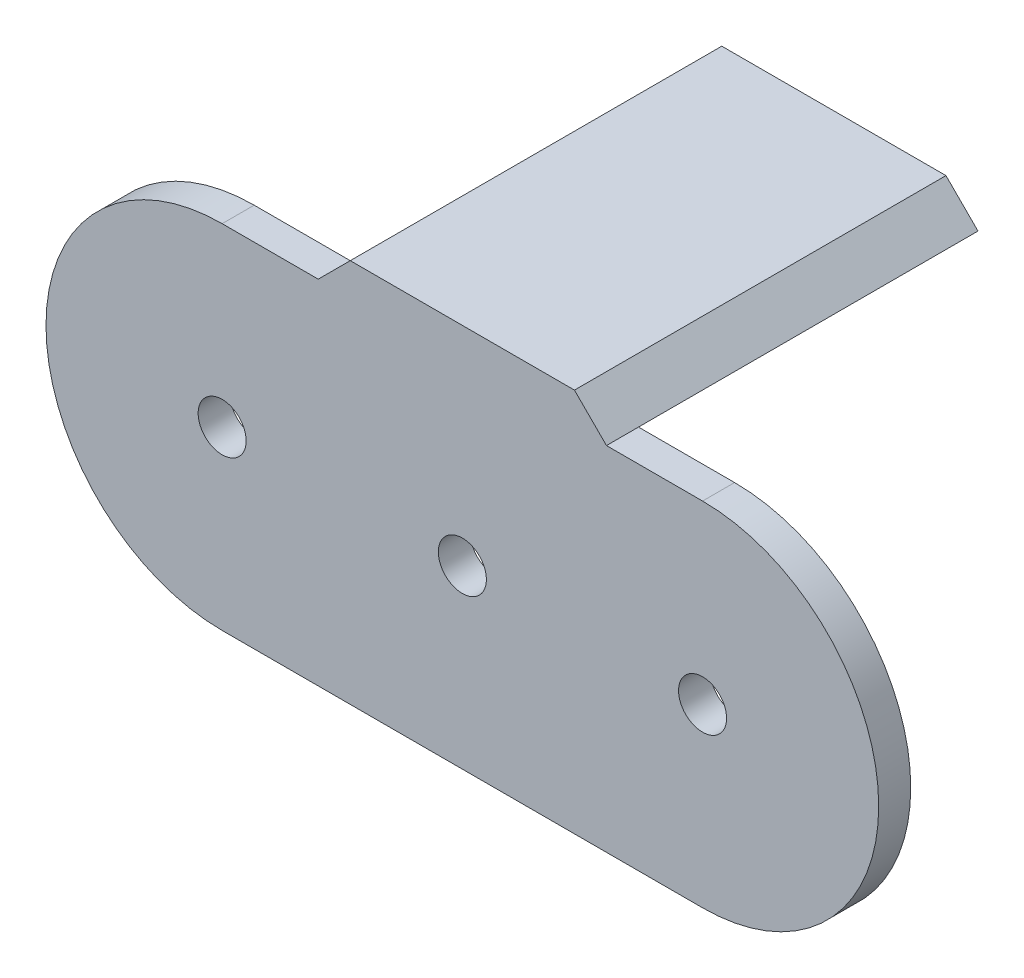
from build123d import *

# Parameters (mm, degrees)
SKETCH1_R           = 1.5
BOSS_EXTRUDE1_DEPTH = 2
SKETCH2_W           = 18
SKETCH2_H           = 23.2
BOSS_EXTRUDE2_DEPTH = 2
CHAMFER1_SIZE       = 2


with BuildPart() as part:
    # Sketch1 → Boss-Extrude1 (new body)
    with BuildSketch(Plane.XY):
        with BuildLine():
            Line((-15, 11), (15, 11))
            ThreePointArc((15, 11), (26, 0), (15, -11))
            Line((15, -11), (-15, -11))
            ThreePointArc((-15, -11), (-26, 0), (-15, 11))
        make_face()
        with Locations((-15, 0)):
            Circle(SKETCH1_R, mode=Mode.SUBTRACT)
        with Locations((15, 0)):
            Circle(SKETCH1_R, mode=Mode.SUBTRACT)
        Circle(SKETCH1_R, mode=Mode.SUBTRACT)
    extrude(amount=BOSS_EXTRUDE1_DEPTH)

    # Sketch2 → Boss-Extrude2 (add)
    with BuildSketch(Plane(origin=(0, 11, 0), x_dir=(1, 0, 0), z_dir=(0, 1, 0))):
        with Locations((0, 9.6)):
            Rectangle(SKETCH2_W, SKETCH2_H)
    extrude(amount=BOSS_EXTRUDE2_DEPTH)

    # Chamfer1
    # the kernel refuses this chamfer: 2 mm, written as the material it takes off along each edge
    with BuildSketch(Plane(origin=(-9, 13, -26.343365976), x_dir=(-0.027495876610586487, -0.9996219169112968, 0), z_dir=(0, 0, 1)), Plane(origin=(9, 13, 7.143365976), x_dir=(0.027495876610586487, -0.9996219169112968, 0), z_dir=(0, 0, -1))) as chamfer1_piece_1:
        Polygon((CHAMFER1_SIZE * 0.999621916911, CHAMFER1_SIZE * 0.0274958766106), (-CHAMFER1_SIZE * 0.0274958766106, CHAMFER1_SIZE * 0.999621916911), (0, 0), align=None)
    extrude(amount=33.486731952, mode=Mode.SUBTRACT)


solid = part.part
